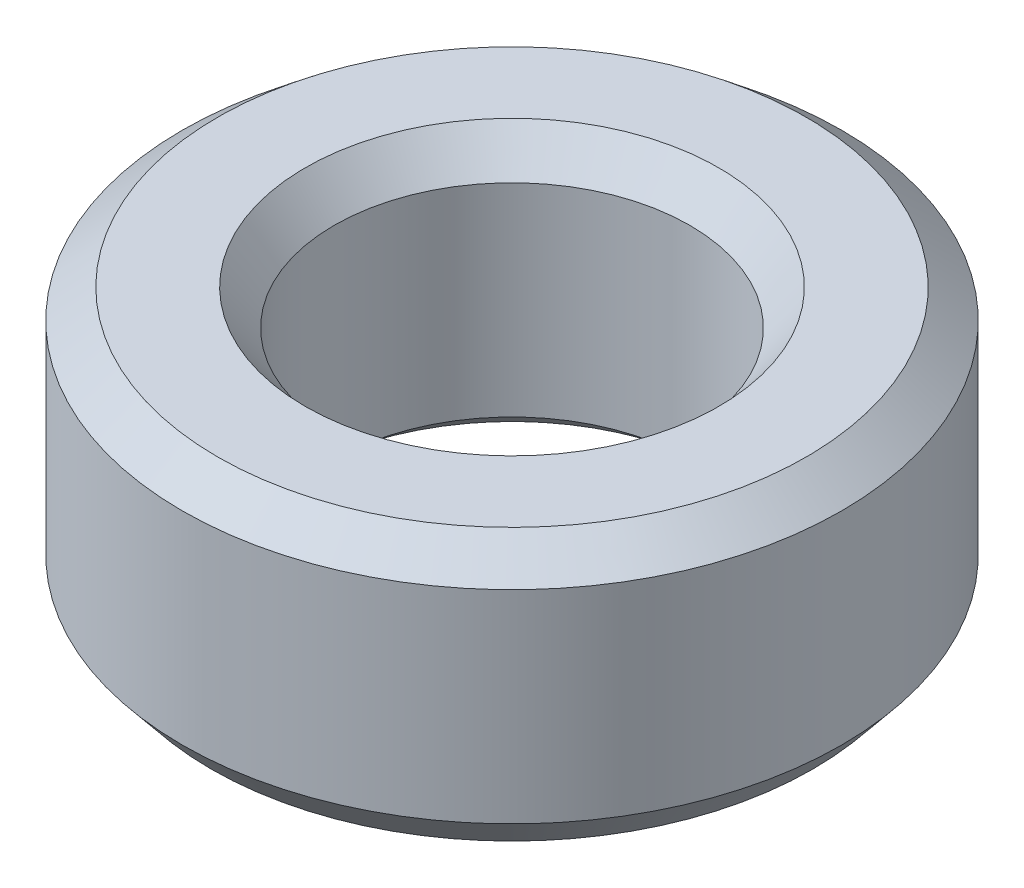
from build123d import *
from OCP.BRepFilletAPI import BRepFilletAPI_MakeChamfer

# Parameters (mm, degrees)
SKETCH1_R           = 27.5
BOSS_EXTRUDE1_DEPTH = 22.282923769
SKETCH2_R           = 14.830237887
CUT_EXTRUDE1_DEPTH  = 45.822189724
CHAMFER1_SIZE       = 2.414881311
CHAMFER1_SIZE2      = 2.952317824


with BuildPart() as part:
    # Sketch1 → Boss-Extrude1 (new body)
    with BuildSketch(Plane(origin=(0, 0, 0), x_dir=(1, 0, 0), z_dir=(0, 1, 0))):
        Circle(SKETCH1_R)
    extrude(amount=BOSS_EXTRUDE1_DEPTH)

    # Sketch2 → Cut-Extrude1 (cut, through all)
    with BuildSketch(Plane(origin=(0, 0, 0), x_dir=(1, 0, 0), z_dir=(0, 1, 0))):
        Circle(SKETCH2_R)
    extrude(amount=CUT_EXTRUDE1_DEPTH, mode=Mode.SUBTRACT)

    # Chamfer1: one chamfer whose edges measure the first distance from different faces: ONE call of the kernel's chamfer builder (chamfer() names one face for all edges)
    chamfer1_edges_1 = [part.edges().sort_by_distance(p)[0] for p in [
        (-14.830237887, 22.282923769, 0),
    ]]
    chamfer1_side_1 = [part.faces().sort_by_distance(p)[0] for p in [
        (-26.722182541, 22.282923769, 0),
    ]]
    chamfer1_edges_2 = [part.edges().sort_by_distance(p)[0] for p in [
        (-14.830237887, 0, 0),
    ]]
    chamfer1_side_2 = [part.faces().sort_by_distance(p)[0] for p in [
        (-14.830237887, 11.141461884, 0),
    ]]
    chamfer1_edges_3 = [part.edges().sort_by_distance(p)[0] for p in [
        (-27.5, 0, 0),
    ]]
    chamfer1_side_3 = [part.faces().sort_by_distance(p)[0] for p in [
        (-26.722182541, 0, 0),
    ]]
    chamfer1_edges_4 = [part.edges().sort_by_distance(p)[0] for p in [
        (-27.5, 22.282923769, 0),
    ]]
    chamfer1_side_4 = [part.faces().sort_by_distance(p)[0] for p in [
        (-27.5, 11.141461884, 0),
    ]]
    chamfer1 = BRepFilletAPI_MakeChamfer(part.part.solid().wrapped)
    for e in chamfer1_edges_1:
        chamfer1.Add(CHAMFER1_SIZE, CHAMFER1_SIZE2, e.wrapped, chamfer1_side_1[0].wrapped)  # the first distance lies on this face
    for e in chamfer1_edges_2:
        chamfer1.Add(CHAMFER1_SIZE, CHAMFER1_SIZE2, e.wrapped, chamfer1_side_2[0].wrapped)  # the first distance lies on this face
    for e in chamfer1_edges_3:
        chamfer1.Add(CHAMFER1_SIZE, CHAMFER1_SIZE2, e.wrapped, chamfer1_side_3[0].wrapped)  # the first distance lies on this face
    for e in chamfer1_edges_4:
        chamfer1.Add(CHAMFER1_SIZE, CHAMFER1_SIZE2, e.wrapped, chamfer1_side_4[0].wrapped)  # the first distance lies on this face
    add(Compound.cast(chamfer1.Shape()), mode=Mode.REPLACE)


solid = part.part
